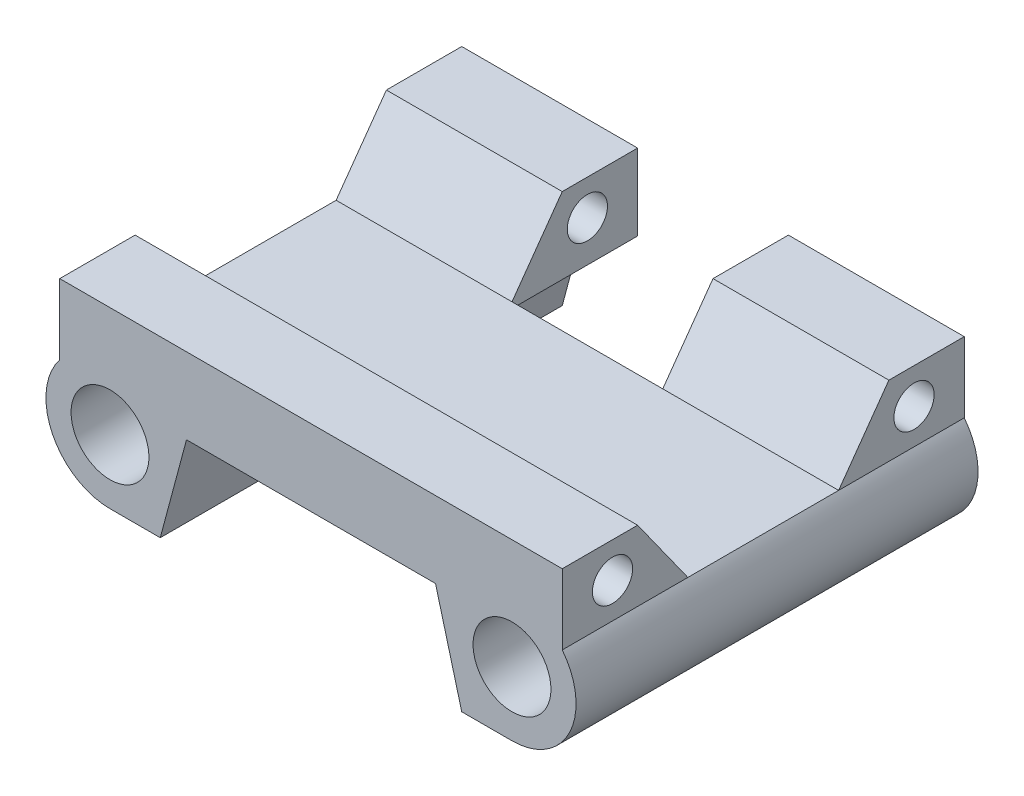
from build123d import *

# Parameters (mm, degrees)
ESBO_O1_R                  = 7.75
RESSALTO_EXTRUS_O1_DEPTH   = 80
CORTE_EXTRUS_O3_DEPTH      = 133.693878359
CORTE_EXTRUS_O3_DEPTH_BACK = 133.693878359
ESBO_O4_R                  = 4
ESBO_O2_W                  = 30
ESBO_O2_H                  = 25
CORTE_EXTRUS_O1_DEPTH      = 102.900522253


with BuildPart() as part:
    # Esboço1 → Ressalto-extrusão1 (new body)
    with BuildSketch(Plane.XY):
        with BuildLine():
            Line((-40, -25.499042945), (-30, -25.499042945))
            Line((-30, -25.499042945), (-24.77524719, -6))
            Line((-24.77524719, -6), (24.77524719, -6))
            Line((24.77524719, -6), (30, -25.499042945))
            Line((30, -25.499042945), (40, -25.499042945))
            ThreePointArc((40, -25.499042945), (51.475727964, -18.304516116), (50, -4.840646851))
            Line((50, -4.840646851), (50, 9.159353149))
            Line((50, 9.159353149), (-50, 9.159353149))
            Line((-50, 9.159353149), (-50, -4.840646851))
            ThreePointArc((-50, -4.840646851), (-51.475727964, -18.304516116), (-40, -25.499042945))
        make_face()
        with Locations((-40, -12.749521473)):
            Circle(ESBO_O1_R, mode=Mode.SUBTRACT)
        with Locations((40, -12.749521473)):
            Circle(ESBO_O1_R, mode=Mode.SUBTRACT)
    extrude(amount=RESSALTO_EXTRUS_O1_DEPTH)

    # Esboço4 → Corte-extrusão3 (cut, two sides: drawn at the far end of the back side and taken through both)
    with BuildSketch(Plane.ZY.offset(50).offset(-CORTE_EXTRUS_O3_DEPTH_BACK)):
        with Locations((10, 2.159353149)):
            Circle(ESBO_O4_R)
        with Locations((70, 2.159353149)):
            Circle(ESBO_O4_R)
        Polygon((15, 9.159353149), (25, -4.840646851), (55, -4.840646851), (65, 9.159353149), align=None)
    extrude(amount=CORTE_EXTRUS_O3_DEPTH + CORTE_EXTRUS_O3_DEPTH_BACK, mode=Mode.SUBTRACT)

    # Esboço2 → Corte-extrusão1 (cut, through all)
    with BuildSketch(Plane.XZ.offset(25.499042945)):
        with Locations((0, 12.5)):
            Rectangle(ESBO_O2_W, ESBO_O2_H)
    extrude(amount=-CORTE_EXTRUS_O1_DEPTH, mode=Mode.SUBTRACT)


solid = part.part
